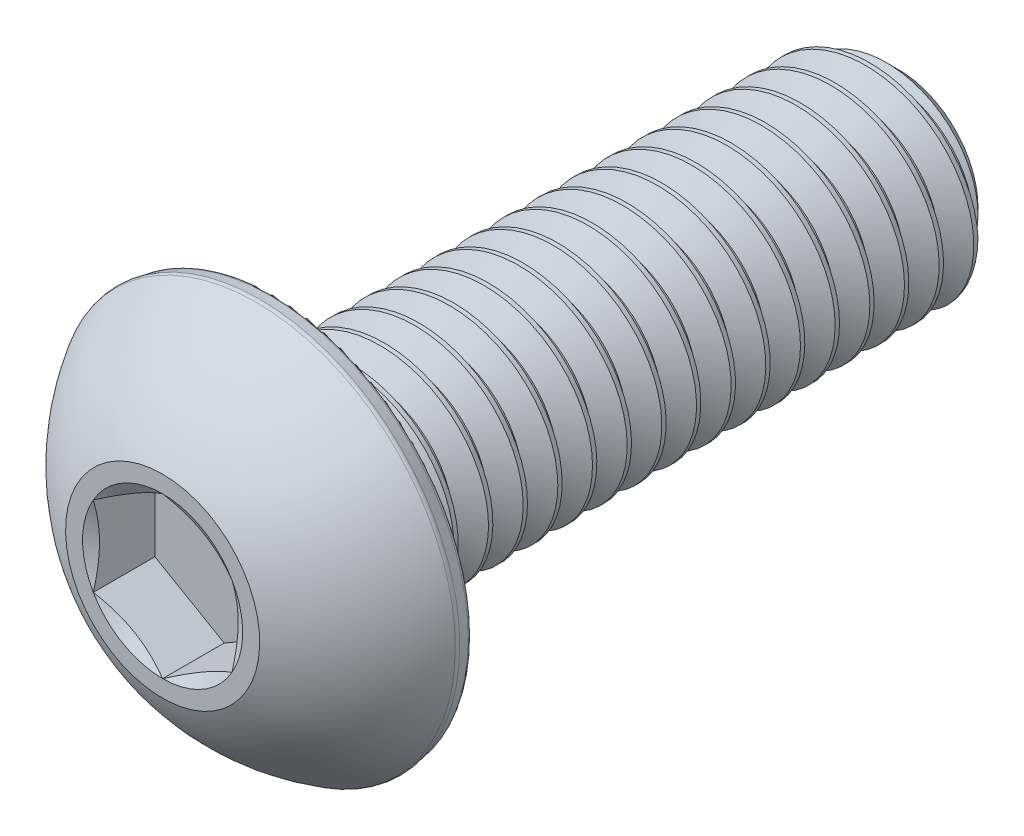
from build123d import *

# Parameters (mm, degrees)
CUT_EXTRUDE1_DEPTH = 1.41097
FILLET1_R          = 0.12827
CUT_SWEEP1_PITCH   = 0.79375
CUT_SWEEP1_TO      = 14.2875


with BuildPart() as part:
    # Sketch3 → Revolve1 (revolve)
    with BuildSketch(Plane(origin=(0, 0, 0), x_dir=(0, 0, -1), z_dir=(1, 0, 0)), mode=Mode.PRIVATE) as revolve1_sk:
        with BuildLine():
            Line((-8.42645, 0), (-8.42645, 2.2225))
            ThreePointArc((-8.42645, 2.2225), (-7.52071038, 3.573966445), (-6.24586, 4.5847))
            Line((-6.24586, 4.5847), (-5.86105, 4.516847615))
            Line((-5.86105, 4.516847615), (-5.86105, 2.413))
            Line((-5.86105, 2.413), (7.8311375, 2.413))
            Line((7.8311375, 2.413), (8.42645, 1.8176875))
            Line((8.42645, 1.8176875), (8.42645, 0))
            Line((8.42645, 0), (-8.42645, 0))
        make_face()
    revolve(revolve1_sk.sketch.rotate(Axis((0, 0, 8.42645), (0, 0, -1)), 90), axis=Axis((0, 0, 8.42645), (0, 0, -1)))

    # Sketch4 → Cut-Extrude1 (cut)
    with BuildSketch(Plane.XY.offset(8.42645)):
        Polygon((-1.5875, -0.916543552), (0, -1.833087105), (1.5875, -0.916543552), (1.5875, 0.916543552), (0, 1.833087105), (-1.5875, 0.916543552), align=None)
    extrude(amount=-CUT_EXTRUDE1_DEPTH, mode=Mode.SUBTRACT)

    # Cut-Extrude2 cone 1 section (through the dimple's axis) → Cut-Extrude2 (revolve, cut)
    with BuildSketch(Plane(origin=(0, 0, 8.42645), x_dir=(0, -1, 0), z_dir=(1, 0, 0))):
        Polygon((0, 0), (1.833087105, 0), (0, 1.058333333), align=None)
    revolve(axis=Axis((0, 0, 8.42645), (0, 0, -1)), mode=Mode.SUBTRACT)

    # Fillet1
    fillet1_edges = [part.edges().sort_by_distance(p)[0] for p in [
        (-4.516847615, 0, 5.86105),
        (-4.5847, 0, 6.24586),
    ]]
    fillet(fillet1_edges, radius=FILLET1_R)


with BuildPart() as body_2:
    # Split1: read off the stored shape, not the designer's step
    # Split1: the piece on the far side of the plane
    add(part.part)
    split(bisect_by=Plane.XY.offset(5.86105), keep=Keep.BOTTOM)

    # Cut-Sweep1: arcs per turn and ends read off the stored shape
    # Cut-Sweep1: the profile of Sketch7 screwed along a right-hand helix through 19 turns, 8 arcs to a turn; built about Z, then put on its axis
    cut_sweep1_z = Axis((0, 0, 0), (0, 0, 1))
    cut_sweep1_corners = [(2.455962979, 0, 0.024804688), (2.455962979, 0, -0.719335937), (1.897444252, 0, -0.396875), (1.897444252, 0, -0.29765625)]
    with BuildLine(mode=Mode.PRIVATE) as cut_sweep1_profile:
        Line(cut_sweep1_corners[0], cut_sweep1_corners[1])
        Line(cut_sweep1_corners[1], cut_sweep1_corners[2])
        Line(cut_sweep1_corners[2], cut_sweep1_corners[3])
        Line(cut_sweep1_corners[3], cut_sweep1_corners[0])
    cut_sweep1_cap = Face(cut_sweep1_profile.wire())
    cut_sweep1_turn_angles = [0, 22.5, 45, 67.5, 90, 112.5, 135, 157.5, 180, 202.5, 225, 247.5, 270, 292.5, 315, 337.5, 360]
    cut_sweep1_turn_weights = [1, 0.9238795325112867, 1, 0.9238795325112867, 1, 0.9238795325112867, 1, 0.9238795325112867, 1, 0.9238795325112867, 1, 0.9238795325112867, 1, 0.9238795325112867, 1, 0.9238795325112867, 1]
    cut_sweep1_turn_rails = [Edge.make_bspline([Vector(p[0], p[1], 0).rotate(cut_sweep1_z, cut_sweep1_turn_angles[k]) / cut_sweep1_turn_weights[k] + Vector(0, 0, p[2] + CUT_SWEEP1_PITCH * cut_sweep1_turn_angles[k] / 360) for k in range(17)], [0, 0, 0, 1, 1, 2, 2, 3, 3, 4, 4, 5, 5, 6, 6, 7, 7, 8, 8, 8], 2, cut_sweep1_turn_weights) for p in cut_sweep1_corners]
    cut_sweep1_turn_sides = [Face.make_surface_from_curves(cut_sweep1_turn_rails[p[0]], cut_sweep1_turn_rails[p[1]]) for p in [(0, 1), (1, 2), (2, 3), (3, 0)]]
    cut_sweep1 = Plane(origin=(0, 0, -8.42645), x_dir=(0, 1, 0), z_dir=(0, 0, 1)) * split(Solid(Shell([*[p.moved(Location((0, 0, CUT_SWEEP1_PITCH * i))) for i in range(19) for p in cut_sweep1_turn_sides], cut_sweep1_cap, cut_sweep1_cap.rotate(cut_sweep1_z, 6840).moved(Location((0, 0, CUT_SWEEP1_PITCH * 6840 / 360)))])), bisect_by=Plane.XY.offset(CUT_SWEEP1_TO), keep=Keep.BOTTOM, mode=Mode.PRIVATE)
    add(cut_sweep1, mode=Mode.SUBTRACT)


with BuildPart() as part_1:
    add(part.part)

    # Split1
    split(bisect_by=Plane.XY.offset(5.86105), keep=Keep.TOP)

    add(body_2.part)  # Boss-Extrude1 merges body 2
    # Boss-Extrude1 cone 1 section (through the dimple's axis) → Boss-Extrude1 (revolve)
    with BuildSketch(Plane(origin=(0, 0, 5.86105), x_dir=(0, -1, 0), z_dir=(1, 0, 0))):
        Polygon((0, 0), (2.498925958, 0), (0, 2.498925958), align=None)
    revolve(axis=Axis((0, 0, 5.86105), (0, 0, -1)))


solid = part_1.part
